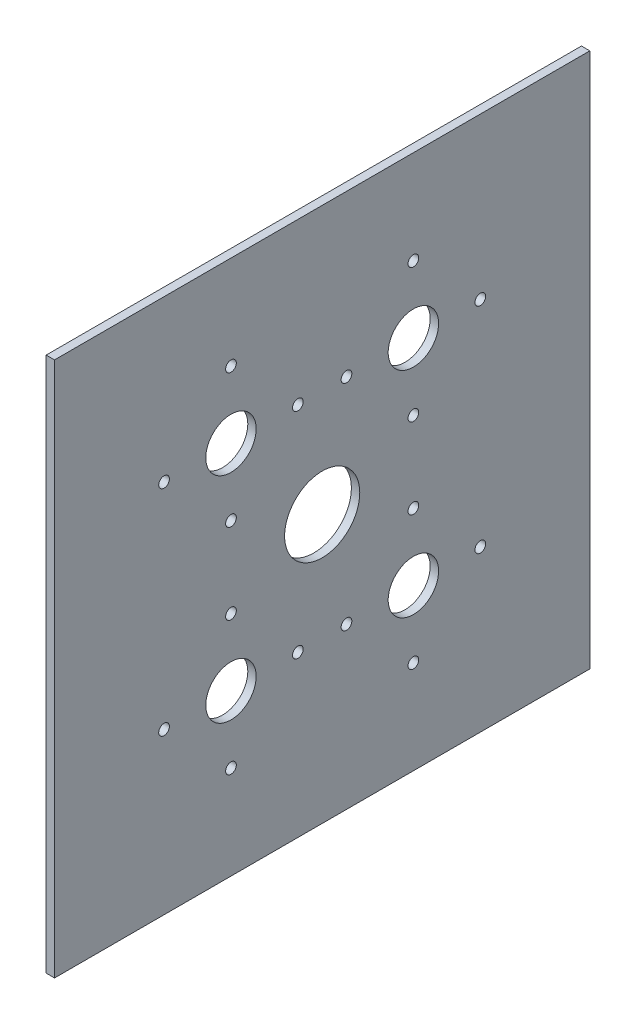
from build123d import *

# Parameters (mm, degrees)
SKETCH1_W          = 203.2
SKETCH1_H          = 203.2
BASE_FLANGE1_DEPTH = 3.175
SKETCH6_R          = 9.5631
SKETCH6_R_2        = 14.2621
SKETCH6_R_3        = 2.032
CUT_EXTRUDE1_DEPTH = 3.175


# Sheet-metal steps are written as plain solids
with BuildPart() as part:
    # Sketch1 → Base-Flange1 (new body)
    with BuildSketch(Plane(origin=(0, 0, 0), x_dir=(0, 0, -1), z_dir=(1, 0, 0))):
        Rectangle(SKETCH1_W, SKETCH1_H)
    extrude(amount=-BASE_FLANGE1_DEPTH)

    # Sketch6 → Cut-Extrude1 (cut)
    with BuildSketch(Plane(origin=(0, 0, 0), x_dir=(0, 0, -1), z_dir=(1, 0, 0))):
        with Locations((-34.6218707, 40.676977416)):
            Circle(SKETCH6_R)
        with Locations((34.6218707, 40.676977416)):
            Circle(SKETCH6_R)
        with Locations((-34.6218707, -40.676977416)):
            Circle(SKETCH6_R)
        with Locations((34.6218707, -40.676977416)):
            Circle(SKETCH6_R)
        Circle(SKETCH6_R_2)
        with Locations((-34.6218707, 66.076977416)):
            Circle(SKETCH6_R_3)
        with Locations((-34.6218707, 15.276977416)):
            Circle(SKETCH6_R_3)
        with Locations((-60.0218707, 40.676977416)):
            Circle(SKETCH6_R_3)
        with Locations((-9.2218707, 40.676977416)):
            Circle(SKETCH6_R_3)
        with Locations(Location((34.6218707, 15.276977416, 0), (0, 0, 180))):
            Circle(SKETCH6_R_3)
        with Locations(Location((60.0218707, 40.676977416, 0), (0, 0, 180))):
            Circle(SKETCH6_R_3)
        with Locations(Location((9.2218707, 40.676977416, 0), (0, 0, 180))):
            Circle(SKETCH6_R_3)
        with Locations(Location((34.6218707, 66.076977416, 0), (0, 0, 180))):
            Circle(SKETCH6_R_3)
        with Locations((34.6218707, -15.276977416)):
            Circle(SKETCH6_R_3)
        with Locations((60.0218707, -40.676977416)):
            Circle(SKETCH6_R_3)
        with Locations((34.6218707, -66.076977416)):
            Circle(SKETCH6_R_3)
        with Locations((9.2218707, -40.676977416)):
            Circle(SKETCH6_R_3)
        with Locations(Location((-9.2218707, -40.676977416, 0), (0, 0, 180))):
            Circle(SKETCH6_R_3)
        with Locations(Location((-34.6218707, -15.276977416, 0), (0, 0, 180))):
            Circle(SKETCH6_R_3)
        with Locations(Location((-60.0218707, -40.676977416, 0), (0, 0, 180))):
            Circle(SKETCH6_R_3)
        with Locations(Location((-34.6218707, -66.076977416, 0), (0, 0, 180))):
            Circle(SKETCH6_R_3)
    extrude(amount=-CUT_EXTRUDE1_DEPTH, mode=Mode.SUBTRACT)


solid = part.part
